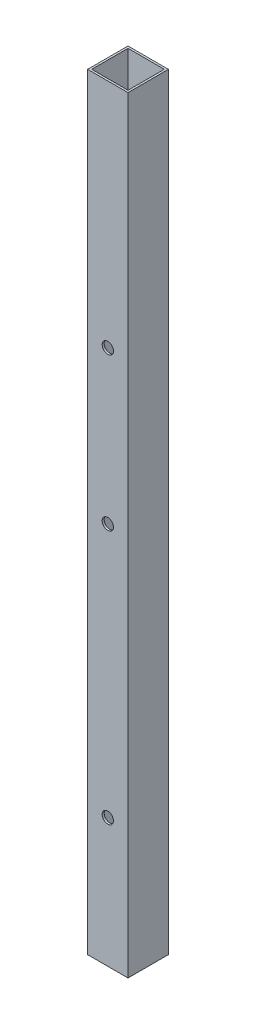
from build123d import *

# Parameters (mm, degrees)
SKETCH1_W           = 25.4
SKETCH1_H           = 25.4
BOSS_EXTRUDE1_DEPTH = 482.6
SKETCH3_R           = 2.54
CUT_EXTRUDE1_DEPTH  = 2.54
SKETCH4_R           = 2.54
CUT_EXTRUDE2_DEPTH  = 2.54
SKETCH5_R           = 2.54
CUT_EXTRUDE3_DEPTH  = 2.54
SKETCH6_R           = 3.556
CUT_EXTRUDE4_DEPTH  = 2.54
SKETCH7_R           = 3.556
CUT_EXTRUDE5_DEPTH  = 2.54


with BuildPart() as part:
    # Sketch1 → Boss-Extrude1 (new body)
    with BuildSketch(Plane(origin=(0, 0, 0), x_dir=(1, 0, 0), z_dir=(0, 1, 0))):
        with Locations((12.7, 12.7)):
            Rectangle(SKETCH1_W, SKETCH1_H)
        Polygon((1.27, 12.361459156), (1.27, 24.13), (12.7, 24.13), (24.13, 24.13), (24.13, 12.7), (24.13, 1.27), (12.7, 1.27), (1.27, 1.27), align=None, mode=Mode.SUBTRACT)
    extrude(amount=BOSS_EXTRUDE1_DEPTH)

    # Sketch3 → Cut-Extrude1 (cut)
    with BuildSketch(Plane(origin=(0, 0, -25.4), x_dir=(-1, 0, 0), z_dir=(0, 0, -1))):
        with Locations((-12.762028981, 449.168015032)):
            Circle(SKETCH3_R)
    extrude(amount=-CUT_EXTRUDE1_DEPTH, mode=Mode.SUBTRACT)

    # Sketch4 → Cut-Extrude2 (cut)
    with BuildSketch(Plane(origin=(0, 0, -25.4), x_dir=(-1, 0, 0), z_dir=(0, 0, -1))):
        with Locations((-12.70057371, 321.200750094)):
            Circle(SKETCH4_R)
    extrude(amount=-CUT_EXTRUDE2_DEPTH, mode=Mode.SUBTRACT)

    # Sketch5 → Cut-Extrude3 (cut)
    with BuildSketch(Plane(origin=(0, 0, -25.4), x_dir=(-1, 0, 0), z_dir=(0, 0, -1))):
        with Locations((-12.715968996, 18.41791766)):
            Circle(SKETCH5_R)
    extrude(amount=-CUT_EXTRUDE3_DEPTH, mode=Mode.SUBTRACT)

    # Sketch6 → Cut-Extrude4 (cut)
    with BuildSketch(Plane.XY):
        with Locations((12.7, 81.078)):
            Circle(SKETCH6_R)
    extrude(amount=-CUT_EXTRUDE4_DEPTH, mode=Mode.SUBTRACT)

    # Sketch7 → Cut-Extrude5 (cut)
    with BuildSketch(Plane.XY):
        with Locations((12.7, 241.126)):
            Circle(SKETCH7_R)
        with Locations((12.7, 337.126)):
            Circle(SKETCH7_R)
    extrude(amount=-CUT_EXTRUDE5_DEPTH, mode=Mode.SUBTRACT)


solid = part.part
